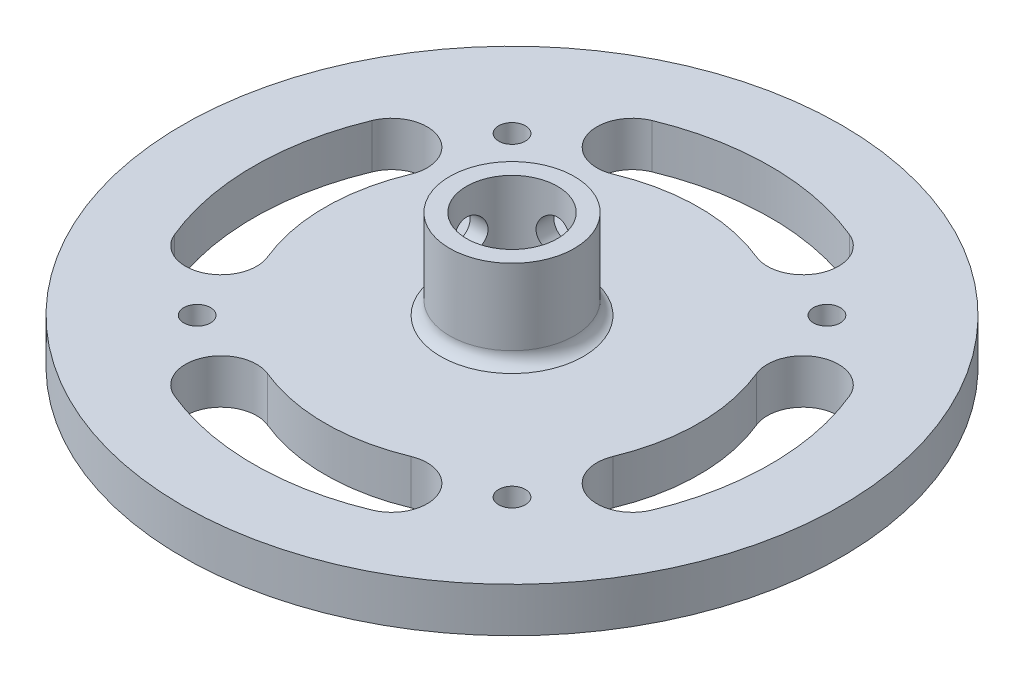
from build123d import *

# Parameters (mm, degrees)
SKETCH_1_R           = 37
EXTRUDE_1_DEPTH      = 40
SKETCH_2_R           = 5.1
CUT_EXTRUDE_1_DEPTH  = 40
CUT_EXTRUDE_2_DEPTH  = 40
SKETCH_4_R           = 7
SKETCH_4_R_2         = 5.1
EXTRUDE_2_DEPTH      = 10
CUT_EXTRUDE_3_REACH  = 74.374
CUT_EXTRUDE_4_REACH  = 74.374
CUT_EXTRUDE_7_REACH  = 74.374
EXTRUDE_START        = -40
SKETCH_14_R          = 36
EXTRUDE_4_DEPTH      = 40
CUT_EXTRUDE_11_DEPTH = 40
CUT_EXTRUDE_START    = -40
SKETCH_17_R          = 5.1
CUT_EXTRUDE_12_DEPTH = 40
SKETCH_21_R          = 37
CUT_EXTRUDE_14_DEPTH = 35
EXTRUDE_START_2      = -5
SKETCH_23_R          = 30
SKETCH_23_R_2        = 5.1
EXTRUDE_5_DEPTH      = 5
CUT_EXTRUDE_15_DEPTH = 5
SKETCH_25_R          = 1.5
CUT_EXTRUDE_16_DEPTH = 5
SKETCH_26_R          = 0.5
CUT_EXTRUDE_18_DEPTH = 2
SKETCH_27_R          = 37
SKETCH_27_R_2        = 36
EXTRUDE_6_DEPTH      = 5


with BuildPart() as part:
    # 草图1 → 凸台-拉伸1 (new body)
    with BuildSketch(Plane(origin=(0, 0, 0), x_dir=(1, 0, 0), z_dir=(0, 1, 0))):
        Circle(SKETCH_1_R)
    extrude(amount=EXTRUDE_1_DEPTH)

    # 草图2 → 切除-拉伸1 (cut)
    with BuildSketch(Plane(origin=(0, 40, 0), x_dir=(1, 0, 0), z_dir=(0, 1, 0))):
        Circle(SKETCH_2_R)
    extrude(amount=-CUT_EXTRUDE_1_DEPTH, mode=Mode.SUBTRACT)

    # 草图3 → 切除-拉伸2 (cut)
    with BuildSketch(Plane(origin=(0, 40, 0), x_dir=(1, 0, 0), z_dir=(0, 1, 0))):
        with BuildLine():
            ThreePointArc((21.650635067, -12.500000048), (23.480762153, -19.330127042), (30.31088915, -17.499999969))
            ThreePointArc((30.31088915, -17.499999969), (35, 0), (30.31088915, 17.499999969))
            ThreePointArc((30.31088915, 17.499999969), (23.48076214, 19.330127034), (21.650635082, 12.500000023))
            ThreePointArc((21.650635082, 12.500000023), (25, -1.5e-08), (21.650635067, -12.500000048))
        make_face()
        with BuildLine():
            ThreePointArc((-4e-09, 25), (5, 30.000000012), (-2.8e-08, 35))
            ThreePointArc((-2.8e-08, 35), (-17.500000023, 30.310889119), (-30.310889145, 17.499999978))
            ThreePointArc((-30.310889145, 17.499999978), (-28.480762154, 10.669873005), (-21.650635155, 12.499999896))
            ThreePointArc((-21.650635155, 12.499999896), (-12.500000054, 21.650635064), (-4e-09, 25))
        make_face()
        with BuildLine():
            ThreePointArc((1.4e-07, -35), (5, -29.99999992), (-1.9e-08, -25))
            ThreePointArc((-1.9e-08, -25), (-12.499999982, -21.650635105), (-21.650635064, -12.500000053))
            ThreePointArc((-21.650635064, -12.500000053), (-28.480762025, -10.66987293), (-30.310889204, -17.499999877))
            ThreePointArc((-30.310889204, -17.499999877), (-17.500000001, -30.310889132), (1.4e-07, -35))
        make_face()
    extrude(amount=-CUT_EXTRUDE_2_DEPTH, mode=Mode.SUBTRACT)

    # 草图4 → 凸台-拉伸2 (add, symmetric)
    with BuildSketch(Plane(origin=(0, 40, 0), x_dir=(1, 0, 0), z_dir=(0, 1, 0))):
        Circle(SKETCH_4_R)
        Circle(SKETCH_4_R_2, mode=Mode.SUBTRACT)
    extrude(amount=EXTRUDE_2_DEPTH, both=True)

    # 草图6 → 切除-拉伸3 (cut, up to next)
    with BuildSketch(Plane.XY, mode=Mode.PRIVATE) as cut_extrude_3_sk1:
        with BuildLine():
            ThreePointArc((0, 47), (-1.414213562, 43.585786438), (2, 45))
            ThreePointArc((2, 45), (1.414213562, 46.414213562), (0, 47))
        make_face()
    cut_extrude_3_tool1 = extrude(cut_extrude_3_sk1.sketch, amount=-CUT_EXTRUDE_3_REACH, mode=Mode.PRIVATE) & part.part
    add(cut_extrude_3_tool1.solids().sort_by_distance((0, 45, 0))[0], mode=Mode.SUBTRACT)

    # 草图7 → 切除-拉伸4 (cut, up to next)
    with BuildSketch(Plane(origin=(0, 0, 0), x_dir=(0, 0, -1), z_dir=(1, 0, 0)), mode=Mode.PRIVATE) as cut_extrude_4_sk1:
        with BuildLine():
            ThreePointArc((0, 47), (-1.414213562, 43.585786438), (2, 45))
            ThreePointArc((2, 45), (1.414213562, 46.414213562), (0, 47))
        make_face()
    cut_extrude_4_tool1 = extrude(cut_extrude_4_sk1.sketch, amount=-CUT_EXTRUDE_4_REACH, mode=Mode.PRIVATE) & part.part
    add(cut_extrude_4_tool1.solids().sort_by_distance((0, 45, 0))[0], mode=Mode.SUBTRACT)

    # 草图10 → 切除-拉伸7 (cut, up to next)
    with BuildSketch(Plane.XZ, mode=Mode.PRIVATE) as cut_extrude_7_sk1:
        with BuildLine():
            Line((0, 36), (0, 37))
            ThreePointArc((0, 37), (-10.740533058, 35.406792422), (-20.556098622, 30.764375655))
            Line((-20.556098622, 30.764375655), (-20.000528389, 29.932906043))
            ThreePointArc((-20.000528389, 29.932906043), (-10.450248381, 34.449852086), (0, 36))
        make_face()
    cut_extrude_7_tool1 = extrude(cut_extrude_7_sk1.sketch, amount=-CUT_EXTRUDE_7_REACH, mode=Mode.PRIVATE) & part.part
    # 草图10 → 切除-拉伸7 (cut, up to next)
    with BuildSketch(Plane.XZ, mode=Mode.PRIVATE) as cut_extrude_7_sk2:
        with BuildLine():
            Line((7.218341915, 36.289055375), (7.023251593, 35.308270095))
            ThreePointArc((7.023251593, 35.308270095), (16.970282526, 31.749165517), (25.455844123, 25.455844123))
            Line((25.455844123, 25.455844123), (26.162950904, 26.162950904))
            ThreePointArc((26.162950904, 26.162950904), (17.441679263, 32.631086781), (7.218341915, 36.289055375))
        make_face()
    cut_extrude_7_tool2 = extrude(cut_extrude_7_sk2.sketch, amount=-CUT_EXTRUDE_7_REACH, mode=Mode.PRIVATE) & part.part
    # 草图10 → 切除-拉伸7 (cut, up to next)
    with BuildSketch(Plane.XZ, mode=Mode.PRIVATE) as cut_extrude_7_sk3:
        with BuildLine():
            Line((30.764375655, 20.556098622), (29.932906043, 20.000528389))
            ThreePointArc((29.932906043, 20.000528389), (34.449852086, 10.450248381), (36, 0))
            Line((36, 0), (37, 0))
            ThreePointArc((37, 0), (35.406792422, 10.740533058), (30.764375655, 20.556098622))
        make_face()
    cut_extrude_7_tool3 = extrude(cut_extrude_7_sk3.sketch, amount=-CUT_EXTRUDE_7_REACH, mode=Mode.PRIVATE) & part.part
    # 草图10 → 切除-拉伸7 (cut, up to next)
    with BuildSketch(Plane.XZ, mode=Mode.PRIVATE) as cut_extrude_7_sk4:
        with BuildLine():
            Line((36.289055375, -7.218341915), (35.308270095, -7.023251593))
            ThreePointArc((35.308270095, -7.023251593), (31.749165517, -16.970282526), (25.455844123, -25.455844123))
            Line((25.455844123, -25.455844123), (26.162950904, -26.162950904))
            ThreePointArc((26.162950904, -26.162950904), (32.631086781, -17.441679263), (36.289055375, -7.218341915))
        make_face()
    cut_extrude_7_tool4 = extrude(cut_extrude_7_sk4.sketch, amount=-CUT_EXTRUDE_7_REACH, mode=Mode.PRIVATE) & part.part
    # 草图10 → 切除-拉伸7 (cut, up to next)
    with BuildSketch(Plane.XZ, mode=Mode.PRIVATE) as cut_extrude_7_sk5:
        with BuildLine():
            Line((20.556098622, -30.764375655), (20.000528389, -29.932906043))
            ThreePointArc((20.000528389, -29.932906043), (10.450248381, -34.449852086), (0, -36))
            Line((0, -36), (0, -37))
            ThreePointArc((0, -37), (10.740533058, -35.406792422), (20.556098622, -30.764375655))
        make_face()
    cut_extrude_7_tool5 = extrude(cut_extrude_7_sk5.sketch, amount=-CUT_EXTRUDE_7_REACH, mode=Mode.PRIVATE) & part.part
    # 草图10 → 切除-拉伸7 (cut, up to next)
    with BuildSketch(Plane.XZ, mode=Mode.PRIVATE) as cut_extrude_7_sk6:
        with BuildLine():
            Line((-7.218341915, -36.289055375), (-7.023251593, -35.308270095))
            ThreePointArc((-7.023251593, -35.308270095), (-16.970282526, -31.749165517), (-25.455844123, -25.455844123))
            Line((-25.455844123, -25.455844123), (-26.162950904, -26.162950904))
            ThreePointArc((-26.162950904, -26.162950904), (-17.441679263, -32.631086781), (-7.218341915, -36.289055375))
        make_face()
    cut_extrude_7_tool6 = extrude(cut_extrude_7_sk6.sketch, amount=-CUT_EXTRUDE_7_REACH, mode=Mode.PRIVATE) & part.part
    # 草图10 → 切除-拉伸7 (cut, up to next)
    with BuildSketch(Plane.XZ, mode=Mode.PRIVATE) as cut_extrude_7_sk7:
        with BuildLine():
            Line((-30.764375655, -20.556098622), (-29.932906043, -20.000528389))
            ThreePointArc((-29.932906043, -20.000528389), (-34.449852086, -10.450248381), (-36, 0))
            Line((-36, 0), (-37, 0))
            ThreePointArc((-37, 0), (-35.406792422, -10.740533058), (-30.764375655, -20.556098622))
        make_face()
    cut_extrude_7_tool7 = extrude(cut_extrude_7_sk7.sketch, amount=-CUT_EXTRUDE_7_REACH, mode=Mode.PRIVATE) & part.part
    # 草图10 → 切除-拉伸7 (cut, up to next)
    with BuildSketch(Plane.XZ, mode=Mode.PRIVATE) as cut_extrude_7_sk8:
        with BuildLine():
            Line((-36.289055375, 7.218341915), (-35.308270095, 7.023251593))
            ThreePointArc((-35.308270095, 7.023251593), (-31.749165517, 16.970282526), (-25.455844123, 25.455844123))
            Line((-25.455844123, 25.455844123), (-26.162950904, 26.162950904))
            ThreePointArc((-26.162950904, 26.162950904), (-32.631086781, 17.441679263), (-36.289055375, 7.218341915))
        make_face()
    cut_extrude_7_tool8 = extrude(cut_extrude_7_sk8.sketch, amount=-CUT_EXTRUDE_7_REACH, mode=Mode.PRIVATE) & part.part
    add(cut_extrude_7_tool1.solids().sort_by_distance((-0.21737, 0, 36.5))[0], mode=Mode.SUBTRACT)
    add(cut_extrude_7_tool2.solids().sort_by_distance((25.653884, 0, 25.964911))[0], mode=Mode.SUBTRACT)
    add(cut_extrude_7_tool3.solids().sort_by_distance((36.5, 0, 0.21737))[0], mode=Mode.SUBTRACT)
    add(cut_extrude_7_tool4.solids().sort_by_distance((25.964911, 0, -25.653884))[0], mode=Mode.SUBTRACT)
    add(cut_extrude_7_tool5.solids().sort_by_distance((0.21737, 0, -36.5))[0], mode=Mode.SUBTRACT)
    add(cut_extrude_7_tool6.solids().sort_by_distance((-25.653884, 0, -25.964911))[0], mode=Mode.SUBTRACT)
    add(cut_extrude_7_tool7.solids().sort_by_distance((-36.5, 0, -0.21737))[0], mode=Mode.SUBTRACT)
    add(cut_extrude_7_tool8.solids().sort_by_distance((-25.964911, 0, 25.653884))[0], mode=Mode.SUBTRACT)

    # 草图14 → 凸台-拉伸4 (add)
    with BuildSketch(Plane(origin=(0, 40, 0), x_dir=(1, 0, 0), z_dir=(0, 1, 0)).offset(EXTRUDE_START)):
        Circle(SKETCH_14_R)
    extrude(amount=EXTRUDE_4_DEPTH)

    # 草图15 → 切除-拉伸11 (cut)
    with BuildSketch(Plane(origin=(0, 40, 0), x_dir=(1, 0, 0), z_dir=(0, 1, 0))):
        with BuildLine():
            ThreePointArc((20, 0), (25, -5), (30, 0))
            ThreePointArc((30, 0), (28.97777479, 7.764571347), (25.980762119, 14.99999999))
            ThreePointArc((25.980762119, 14.99999999), (19.150635111, 16.830127029), (17.320508062, 10.000000023))
            ThreePointArc((17.320508062, 10.000000023), (19.318516522, 5.176380915), (20, 0))
        make_face()
        with BuildLine():
            ThreePointArc((17.320508096, -9.999999964), (14.142135686, -14.142135561), (10.000000118, -17.320508008))
            ThreePointArc((10.000000118, -17.320508008), (8.169872923, -24.150634995), (14.999999918, -25.980762161))
            ThreePointArc((14.999999918, -25.980762161), (21.213203317, -21.213203554), (25.980761993, -15.000000208))
            ThreePointArc((25.980761993, -15.000000208), (24.150635217, -8.169873051), (17.320508096, -9.999999964))
        make_face()
        with BuildLine():
            ThreePointArc((10.0000001, 17.320508018), (16.830127018, 19.150635093), (15.000000104, 25.980762053))
            ThreePointArc((15.000000104, 25.980762053), (7.764571417, 28.977774771), (1.3e-08, 30))
            ThreePointArc((1.3e-08, 30), (-5, 24.999999982), (4.9e-08, 20))
            ThreePointArc((4.9e-08, 20), (5.176380982, 19.318516504), (10.0000001, 17.320508018))
        make_face()
        with BuildLine():
            ThreePointArc((-15.000000208, -25.980761993), (-7.764571442, -28.977774765), (5.6e-08, -30))
            ThreePointArc((5.6e-08, -30), (5, -24.999999981), (1.9e-08, -20))
            ThreePointArc((1.9e-08, -20), (-5.176380827, -19.318516546), (-9.999999881, -17.320508144))
            ThreePointArc((-9.999999881, -17.320508144), (-16.830126924, -19.150634931), (-15.000000208, -25.980761993))
        make_face()
        with BuildLine():
            ThreePointArc((-17.320508134, 9.999999899), (-14.142135725, 14.142135523), (-10.000000147, 17.320507991))
            ThreePointArc((-10.000000147, 17.320507991), (-8.169872936, 24.150635016), (-14.99999999, 25.980762119))
            ThreePointArc((-14.99999999, 25.980762119), (-21.213203332, 21.213203539), (-25.980761973, 15.000000244))
            ThreePointArc((-25.980761973, 15.000000244), (-24.150635267, 8.169873081), (-17.320508134, 9.999999899))
        make_face()
        with BuildLine():
            ThreePointArc((-30, -8.8e-08), (-28.97777479, -7.76457135), (-25.980762161, -14.999999918))
            ThreePointArc((-25.980762161, -14.999999918), (-19.150635148, -16.83012705), (-17.320508061, -10.000000025))
            ThreePointArc((-17.320508061, -10.000000025), (-19.318516522, -5.176380916), (-20, 0))
            ThreePointArc((-20, 0), (-25.000000044, 5), (-30, -8.8e-08))
        make_face()
    extrude(amount=-CUT_EXTRUDE_11_DEPTH, mode=Mode.SUBTRACT)

    # 草图17 → 切除-拉伸12 (cut)
    with BuildSketch(Plane(origin=(0, 40, 0), x_dir=(1, 0, 0), z_dir=(0, 1, 0)).offset(CUT_EXTRUDE_START)):
        Circle(SKETCH_17_R)
    extrude(amount=CUT_EXTRUDE_12_DEPTH, mode=Mode.SUBTRACT)

    # 草图20 → 旋转1 (revolve)
    with BuildSketch(Plane.XY):
        with BuildLine():
            Line((-7, 40), (-7, 41.500033854))
            ThreePointArc((-7, 41.500033854), (-7.278579145, 40.593565511), (-8.018154145, 40))
            Line((-8.018154145, 40), (-7, 40))
        make_face()
    revolve(axis=Axis((0, -950, 0), (0, 1, 0)))

    # 草图21 → 切除-拉伸14 (cut)
    with BuildSketch(Plane.XZ):
        Circle(SKETCH_21_R)
    extrude(amount=-CUT_EXTRUDE_14_DEPTH, mode=Mode.SUBTRACT)

    # 草图23 → 凸台-拉伸5 (add)
    with BuildSketch(Plane.XZ.offset(-35).offset(EXTRUDE_START_2)):
        Circle(SKETCH_23_R)
        Circle(SKETCH_23_R_2, mode=Mode.SUBTRACT)
    extrude(amount=EXTRUDE_5_DEPTH)

    # 草图24 → 切除-拉伸15 (cut)
    with BuildSketch(Plane.XZ.offset(-35)):
        with BuildLine():
            ThreePointArc((19.401470113, -8.036352248), (21.566254557, -13.262603928), (26.792506351, -11.09781976))
            ThreePointArc((26.792506351, -11.09781976), (29, -1.26e-07), (26.792506447, 11.097819528))
            ThreePointArc((26.792506447, 11.097819528), (21.566254619, 13.262603954), (19.401470158, 8.036352139))
            ThreePointArc((19.401470158, 8.036352139), (21, -5.9e-08), (19.401470113, -8.036352248))
        make_face()
        with BuildLine():
            ThreePointArc((8.036352002, 19.401470215), (13.26260387, 21.566254417), (11.097819794, 26.792506337))
            ThreePointArc((11.097819794, 26.792506337), (2.06e-07, 29), (-11.097819413, 26.792506495))
            ThreePointArc((-11.097819413, 26.792506495), (-13.262603965, 21.566254645), (-8.036352077, 19.401470184))
            ThreePointArc((-8.036352077, 19.401470184), (-4.1e-08, 21), (8.036352002, 19.401470215))
        make_face()
        with BuildLine():
            ThreePointArc((11.097819528, -26.792506447), (13.262603965, -21.566254646), (8.036352195, -19.401470135))
            ThreePointArc((8.036352195, -19.401470135), (-3e-09, -21), (-8.0363522, -19.401470133))
            ThreePointArc((-8.0363522, -19.401470133), (-13.262603948, -21.566254605), (-11.097819615, -26.792506411))
            ThreePointArc((-11.097819615, -26.792506411), (-4.8e-08, -29), (11.097819528, -26.792506447))
        make_face()
        with BuildLine():
            ThreePointArc((-19.401470215, 8.036352001), (-21.566254478, 13.262603896), (-26.792506388, 11.097819671))
            ThreePointArc((-26.792506388, 11.097819671), (-29, 1.55e-07), (-26.792506507, -11.097819384))
            ThreePointArc((-26.792506507, -11.097819384), (-21.566254645, -13.262603965), (-19.401470195, -8.036352049))
            ThreePointArc((-19.401470195, -8.036352049), (-21, -2.6e-08), (-19.401470215, 8.036352001))
        make_face()
    extrude(amount=-CUT_EXTRUDE_15_DEPTH, mode=Mode.SUBTRACT)

    # 草图25 → 切除-拉伸16 (cut)
    with BuildSketch(Plane.XZ.offset(-35)):
        with Locations((17.67766953, 17.67766953)):
            Circle(SKETCH_25_R)
        with Locations((17.67766953, -17.67766953)):
            Circle(SKETCH_25_R)
        with Locations((-17.67766953, 17.67766953)):
            Circle(SKETCH_25_R)
        with Locations((-17.67766953, -17.67766953)):
            Circle(SKETCH_25_R)
    extrude(amount=-CUT_EXTRUDE_16_DEPTH, mode=Mode.SUBTRACT)

    # 草图26 → 切除-拉伸18 (cut)
    with BuildSketch(Plane.XZ.offset(-35)):
        with Locations((-17.67766953, 20.17766953)):
            Circle(SKETCH_26_R)
        with Locations((-15.17766953, 17.67766953)):
            Circle(SKETCH_26_R)
        with Locations((-17.67766953, 15.17766953)):
            Circle(SKETCH_26_R)
        with Locations((-20.17766953, 17.67766953)):
            Circle(SKETCH_26_R)
        with Locations((-15.17766953, -17.67766953)):
            Circle(SKETCH_26_R)
        with Locations((-20.17766953, -17.67766953)):
            Circle(SKETCH_26_R)
        with Locations((-17.67766953, -15.17766953)):
            Circle(SKETCH_26_R)
        with Locations((-17.67766953, -20.17766953)):
            Circle(SKETCH_26_R)
        with Locations((20.17766953, -17.67766953)):
            Circle(SKETCH_26_R)
        with Locations((17.67766953, -20.17766953)):
            Circle(SKETCH_26_R)
        with Locations((15.17766953, -17.67766953)):
            Circle(SKETCH_26_R)
        with Locations((17.67766953, -15.17766953)):
            Circle(SKETCH_26_R)
        with Locations((15.17766953, 17.67766953)):
            Circle(SKETCH_26_R)
        with Locations((17.67766953, 15.17766953)):
            Circle(SKETCH_26_R)
        with Locations((17.67766953, 20.17766953)):
            Circle(SKETCH_26_R)
        with Locations((20.17766953, 17.67766953)):
            Circle(SKETCH_26_R)
    extrude(amount=-CUT_EXTRUDE_18_DEPTH, mode=Mode.SUBTRACT)

    # 草图27 → 凸台-拉伸6 (add)
    with BuildSketch(Plane(origin=(0, 40, 0), x_dir=(1, 0, 0), z_dir=(0, 1, 0)).offset(EXTRUDE_START_2)):
        Circle(SKETCH_27_R)
        Circle(SKETCH_27_R_2, mode=Mode.SUBTRACT)
    extrude(amount=EXTRUDE_6_DEPTH)


solid = part.part
